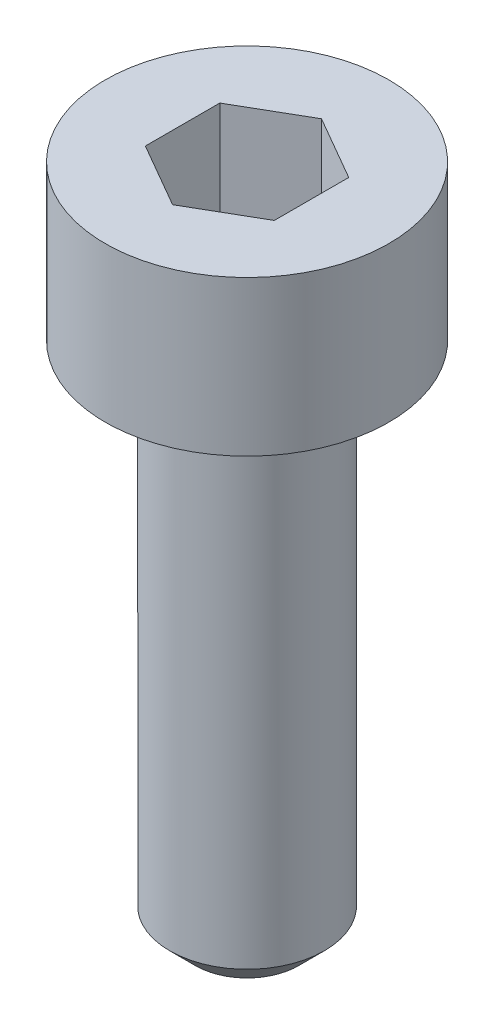
from build123d import *

# Parameters (mm, degrees)
CUT_EXTRUDE_517_DEPTH = 2
CHAMFER1_SIZE         = 0.5


with BuildPart() as part:
    # Sketch1 → Revolve1 (revolve)
    with BuildSketch(Plane.XY):
        Polygon((0, 13), (-2.75, 13), (-2.75, 10), (-1.5, 10), (-1.5, 0), (0, 0), align=None)
    revolve(axis=Axis((0, 0, 0), (0, 1, 0)))

    # Sketch2 → Cut-Extrude 517 (cut)
    with BuildSketch(Plane(origin=(0, 13, 0), x_dir=(1, 0, 0), z_dir=(0, 1, 0))):
        Polygon((0, 1.443375673), (-1.25, 0.721687836), (-1.25, -0.721687836), (0, -1.443375673), (1.25, -0.721687836), (1.25, 0.721687836), align=None)
    extrude(amount=-CUT_EXTRUDE_517_DEPTH, mode=Mode.SUBTRACT)

    # Chamfer1
    chamfer1_edges = [part.edges().sort_by_distance(p)[0] for p in [
        (1.5, 0, 0),
    ]]
    chamfer(chamfer1_edges, length=CHAMFER1_SIZE)


solid = part.part
